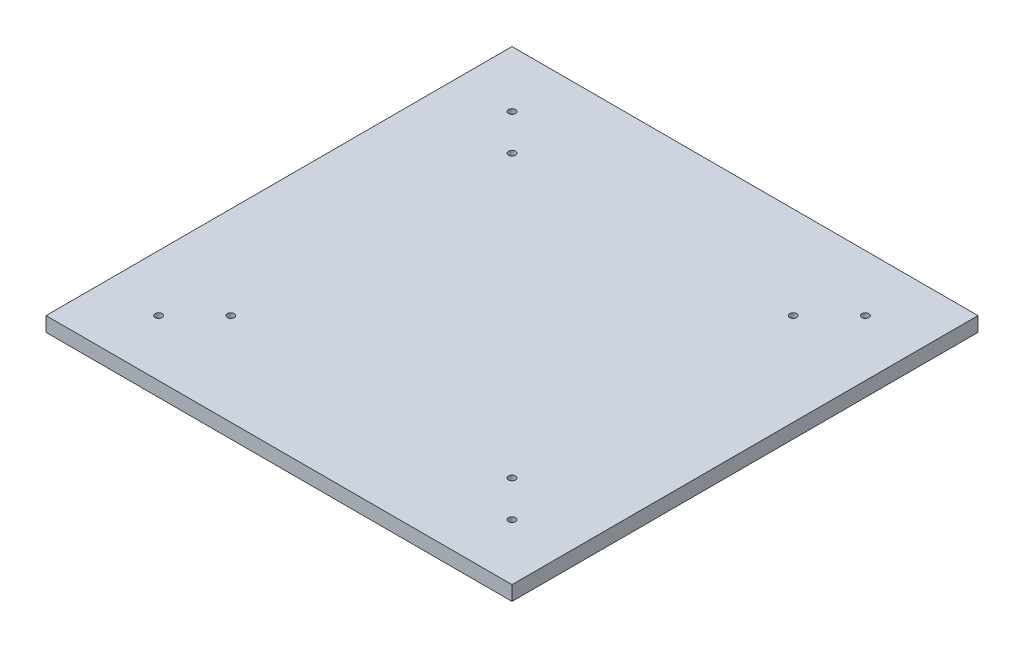
from build123d import *

# Parameters (mm, degrees)
SKETCH1_W           = 160
SKETCH1_H           = 160
SKETCH1_R           = 1.2
BOSS_EXTRUDE1_DEPTH = 5


with BuildPart() as part:
    # Sketch1 → Boss-Extrude1 (new body)
    with BuildSketch(Plane(origin=(0, 0, 0), x_dir=(1, 0, 0), z_dir=(0, 1, 0))):
        Rectangle(SKETCH1_W, SKETCH1_H)
        with Locations((-60.664206642, 60.664206642)):
            Circle(SKETCH1_R, mode=Mode.SUBTRACT)
        with Locations((-48.279552135, 48.279552135)):
            Circle(SKETCH1_R, mode=Mode.SUBTRACT)
        with Locations((48.279552135, 48.279552135)):
            Circle(SKETCH1_R, mode=Mode.SUBTRACT)
        with Locations((60.664206642, 60.664206642)):
            Circle(SKETCH1_R, mode=Mode.SUBTRACT)
        with Locations((60.664206642, -60.664206642)):
            Circle(SKETCH1_R, mode=Mode.SUBTRACT)
        with Locations((48.279552135, -48.279552135)):
            Circle(SKETCH1_R, mode=Mode.SUBTRACT)
        with Locations((-48.279552135, -48.279552135)):
            Circle(SKETCH1_R, mode=Mode.SUBTRACT)
        with Locations((-60.664206642, -60.664206642)):
            Circle(SKETCH1_R, mode=Mode.SUBTRACT)
    extrude(amount=BOSS_EXTRUDE1_DEPTH)


solid = part.part
